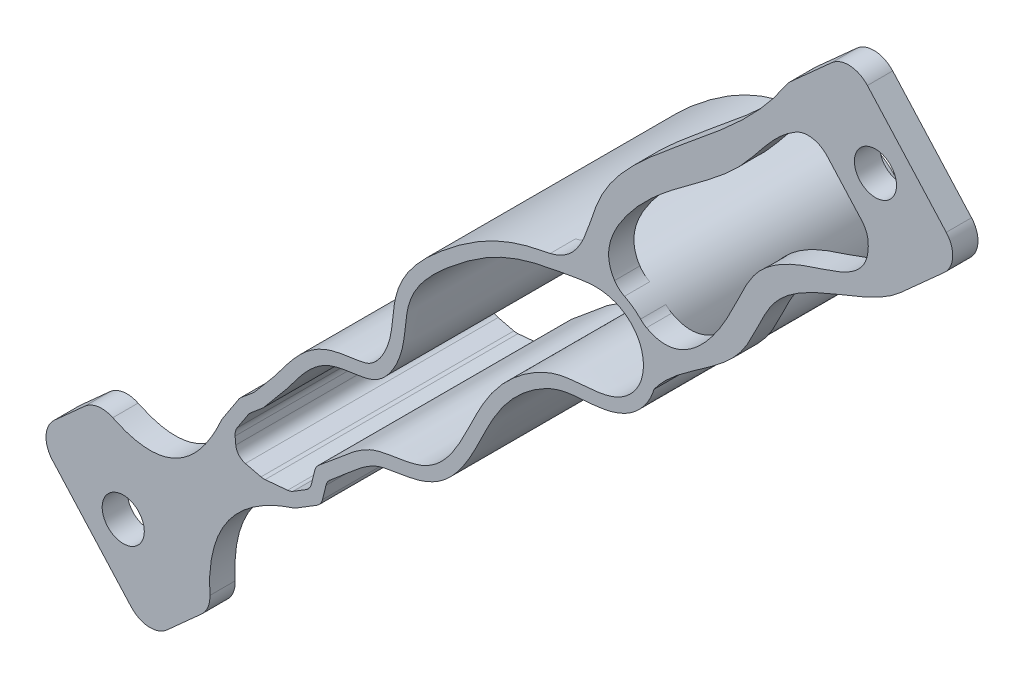
from build123d import *

# Parameters (mm, degrees)
AUFSATZ_LINEAR_AUSTRAGEN1_DEPTH = 30
SKIZZE4_R                       = 2.5
AUFSATZ_LINEAR_AUSTRAGEN2_DEPTH = 3
VERRUNDUNG5_R                   = 3
VERRUNDUNG6_R                   = 1.5


# Read off the part's stored shape, not the designer's step: Aufsatz-Linear austragen1
with BuildPart() as part:
    # Aufsatz-Linear austragen1 outline → Aufsatz-Linear austragen1 (new body)
    with BuildSketch(Plane.XY):
        with BuildLine():
            Line((21.502621057, 72.469360005), (22.177877758, 75.237826578))
            add(Edge.make_bspline(
                [(22.177877758, 75.237826578), (22.254256124, 75.299864428), (22.401406283, 75.416739858), (22.754083676, 75.691285806), (23.277364922, 76.10757001), (23.875701394, 76.622425746), (24.647522639, 77.304476478), (25.579741944, 78.125858601), (26.660997946, 78.968105965), (27.696607507, 79.586792473), (28.631268767, 79.929206924), (29.970663186, 80.187124193), (31.559028302, 80.417471171), (33.35144059, 80.779313105), (35.30968719, 81.656906085), (36.829680735, 82.918083951), (38.436897478, 84.838185933), (39.883208597, 87.452574238), (41.318550587, 90.52644951), (42.738396859, 93.001025129), (44.412581155, 95.03705019), (46.405889796, 96.758782997), (48.313567649, 97.879876665), (49.811329694, 98.417647898), (50.922124033, 98.632157767), (52.331756866, 98.757646615), (53.942485181, 98.877946479), (55.518870379, 99.103340596), (56.913656853, 99.546285355), (58.001421873, 100.091720884), (58.975778788, 100.82811088), (59.811633543, 101.71853364), (60.492503588, 102.754822756), (60.988413159, 103.947261816), (61.233819472, 105.212823321), (61.239900068, 106.889450409), (60.805664637, 108.527353464), (59.865073844, 110.019475832), (58.686693643, 111.231611144), (57.287286599, 112.057728079), (55.73639162, 112.51185954), (54.241451724, 112.694379486), (52.557511214, 112.580640152), (50.900308103, 112.278519561), (49.028258896, 111.949905855), (46.668529461, 111.509257638), (43.782844471, 110.680507348), (41.243036148, 109.514515987), (39.102547034, 108.207509439), (37.414184715, 107.011672545), (35.640883022, 105.599618111), (33.661677283, 103.843992247), (32.080114304, 102.019591381), (31.043875531, 100.300674013), (30.438792823, 98.79955445), (30.13880339, 97.341373341), (29.992721316, 96.055411287), (29.879519712, 94.90912216), (29.681769358, 93.623299713), (29.1603909, 92.05102678), (28.339762848, 90.768505317), (27.635981643, 90.10581023), (27.217269934, 89.846143896), (26.877783825, 89.708231837), (26.409438656, 89.569512488), (25.627679248, 89.428102345), (24.427519261, 89.274247733), (23.249472433, 89.068255199), (22.225694736, 88.768681136), (21.137853335, 88.320349733), (19.957924312, 87.556139753), (18.818781666, 86.511882155), (17.554921806, 85.065772551), (16.579598585, 83.705497378), (15.781602284, 82.684970689), (15.146612066, 81.91384843), (14.544102184, 81.206855981), (13.999836903, 80.572985234), (13.68706761, 80.208891755), (13.536003767, 80.032532964)],
                knots=[0.373322978, 0.373322978, 0.373322978, 0.373322978, 0.376528797, 0.379734617, 0.386146256, 0.392557895, 0.398969535, 0.411792813, 0.424616091, 0.43743937, 0.450262648, 0.463085927, 0.475909205, 0.488732483, 0.501555762, 0.51437904, 0.527202319, 0.552848875, 0.578495432, 0.604141989, 0.629788546, 0.655435103, 0.681081659, 0.693904938, 0.706728216, 0.719551495, 0.732374773, 0.745198051, 0.751609691, 0.75802133, 0.764432969, 0.770844608, 0.777256247, 0.783667887, 0.790079526, 0.796491165, 0.809314443, 0.815726083, 0.822137722, 0.834961, 0.841372639, 0.847784279, 0.860607557, 0.873430835, 0.886254114, 0.911900671, 0.937547227, 0.963193784, 0.976017063, 0.988840341, 1.001663619, 1.014486898, 1.027310176, 1.033721815, 1.040133455, 1.046545094, 1.052956733, 1.059368372, 1.065780011, 1.07860329, 1.091426568, 1.097838207, 1.104249847, 1.107455666, 1.110661486, 1.117073125, 1.123484764, 1.129896403, 1.133102223, 1.136308043, 1.142719682, 1.149131321, 1.15554296, 1.168366239, 1.174777878, 1.181189517, 1.187601156, 1.190806976, 1.194012795, 1.194012795, 1.194012795, 1.194012795], degree=3))
            Line((13.536003767, 80.032532964), (11.822906277, 78.595073491))
            Line((11.822906277, 78.595073491), (9.687044037, 75.317164454))
            Line((9.687044037, 75.317164454), (10.053403602, 71.255635543))
            Line((10.053403602, 71.255635543), (14.475267585, 70.177098668))
            Line((14.475267585, 70.177098668), (18.341234762, 70.5258181))
            Line((18.341234762, 70.5258181), (21.502621057, 72.469360005))
        make_face()
        with BuildLine():
            add(Edge.make_bspline(
                [(20.834793722, 76.061451858), (20.982005484, 76.196777022), (21.276446541, 76.443244796), (21.809392251, 76.854719355), (22.395228981, 77.325787697), (23.161775957, 77.989275726), (24.12322295, 78.850039457), (25.299890873, 79.831893247), (26.523519613, 80.666838055), (28.159762679, 81.438240117), (30.179083341, 81.717053226), (32.323329198, 82.079584767), (33.946931742, 82.624375114), (35.333501298, 83.577165331), (36.842393369, 85.174069178), (38.282016568, 87.588894944), (39.735209989, 90.694487024), (41.240682307, 93.479520835), (43.046396867, 95.788146816), (45.191944861, 97.735197117), (47.298908301, 99.057741191), (49.070157619, 99.767787687), (50.85008262, 100.183465945), (52.878076716, 100.274128046), (55.100072487, 100.538144068), (56.867295949, 101.083413553), (58.430174676, 102.286080097), (59.501852985, 103.961784273), (59.848216567, 105.969747456), (59.46188968, 107.932703522), (58.316760191, 109.628882316), (56.681834243, 110.718732589), (54.808980056, 111.194995787), (53.031772201, 111.127349342), (51.399125844, 110.84794883), (49.466716943, 110.501377151), (47.166795584, 110.082199501), (44.453627463, 109.321992035), (41.618592742, 108.050721353), (39.028143269, 106.370709826), (36.729284053, 104.552504665), (34.837130056, 102.890799513), (33.37546251, 101.234271806), (32.449215546, 99.738391359), (31.747307515, 98.083258171), (31.479504351, 95.97512579), (31.282650556, 93.70034002), (30.56287413, 91.475874003), (29.568389599, 89.875995413), (28.597006456, 88.940107724), (27.811516639, 88.438318776), (26.924604688, 88.136661039), (25.835020273, 87.942161361), (24.62881228, 87.786947522), (23.35652081, 87.564805619), (22.030199882, 87.110465523), (20.474275175, 86.097963756), (18.958316824, 84.446558328), (17.758061478, 82.775704685), (16.910126576, 81.694228865), (16.246871139, 80.891606673), (15.624903688, 80.162882321), (15.067148562, 79.51349651), (14.748876803, 79.142916853), (14.595029918, 78.963050482)],
                knots=[0.367648597, 0.367648597, 0.367648597, 0.367648597, 0.374108802, 0.380569007, 0.387029212, 0.393489418, 0.406409828, 0.419330238, 0.432250648, 0.445171059, 0.471011879, 0.483932289, 0.4968527, 0.50977311, 0.52269352, 0.548534341, 0.574375161, 0.600215982, 0.626056802, 0.651897623, 0.677738443, 0.690658853, 0.703579264, 0.729420084, 0.742340494, 0.755260904, 0.768181315, 0.781101725, 0.794022135, 0.806942545, 0.819862956, 0.832783366, 0.845703776, 0.858624186, 0.871544597, 0.884465007, 0.910305827, 0.936146648, 0.961987468, 0.987828289, 1.000748699, 1.013669109, 1.02658952, 1.033049725, 1.03950993, 1.05243034, 1.06535075, 1.078271161, 1.091191571, 1.097651776, 1.104111981, 1.110572186, 1.117032391, 1.123492596, 1.129952802, 1.136413007, 1.142873212, 1.155793622, 1.168714032, 1.175174237, 1.181634443, 1.188094648, 1.19132475, 1.194554853, 1.194554853, 1.194554853, 1.194554853], degree=3))
            Line((20.834793722, 76.061451858), (20.191521996, 73.424119612))
            Line((20.191521996, 73.424119612), (17.855695294, 71.988111274))
            Line((17.855695294, 71.988111274), (14.588656062, 71.693416567))
            Line((14.588656062, 71.693416567), (11.450971684, 72.458729186))
            Line((11.450971684, 72.458729186), (11.227697925, 74.93398277))
            Line((11.227697925, 74.93398277), (12.957915036, 77.589347988))
            Line((12.957915036, 77.589347988), (14.595029918, 78.963050482))
        make_face(mode=Mode.SUBTRACT)
    extrude(amount=AUFSATZ_LINEAR_AUSTRAGEN1_DEPTH)

    # Skizze4 → Aufsatz-Linear austragen2 (add)
    # profile 1 of 4: a face of its own
    with BuildSketch(Plane.XY.offset(30)):
        Polygon((84.30628697, 150.190951605), (76.866971114, 143.508393742), (80.184370385, 139.815319698), (86.235506325, 133.078930359), (90.232086841, 128.62976203), (97.671402697, 135.312319894), align=None)
        with Locations((87.269186906, 139.410356818)):
            Circle(SKIZZE4_R, mode=Mode.SUBTRACT)
    # profile 2 of 4: a face of its own
    with BuildSketch(Plane.XY.offset(30)):
        with BuildLine():
            add(Edge.make_bspline(
                [(-4.965503299, 70.000257243), (4.653267601, 63.937882303), (9.687044037, 75.317164454)],
                knots=[0, 0, 0, 1, 1, 1], degree=2))
            Line((-4.965503299, 70.000257243), (-12.404819154, 63.31769938))
            Line((-12.404819154, 63.31769938), (0.960296573, 48.439067669))
            Line((0.960296573, 48.439067669), (8.399612428, 55.121625532))
            add(Edge.make_bspline(
                [(8.399612428, 55.121625532), (6.958597909, 66.912785044), (18.341234762, 70.5258181)],
                knots=[0, 0, 0, 1, 1, 1], degree=2))
            Line((18.341234762, 70.5258181), (14.475267585, 70.177098668))
            Line((14.475267585, 70.177098668), (10.053403602, 71.255635543))
            Line((10.053403602, 71.255635543), (9.687044037, 75.317164454))
        make_face()
        with Locations((-2.002603363, 59.219662456)):
            Circle(SKIZZE4_R, mode=Mode.SUBTRACT)
    # profile 3 of 4: a face of its own
    with BuildSketch(Plane.XY.offset(30)):
        with BuildLine():
            add(Edge.make_bspline(
                [(76.866971114, 143.508393742), (72.687124199, 136.816455913), (63.441453447, 131.01252398), (53.186506212, 120.519346265), (52.716796175, 112.832236542), (48.673620881, 111.880000188)],
                knots=[0, 0, 0, 0, 0.53661385, 0.757250372, 1, 1, 1, 1], degree=3))
            add(Edge.make_bspline(
                [(56.970920735, 112.107299655), (56.942998255, 112.118460851), (56.540848672, 112.27629926), (55.73639162, 112.51185954), (54.241451724, 112.694379486), (52.557511214, 112.580640152), (50.900308103, 112.278519561), (49.691742908, 112.066371779), (48.94790706, 111.931389695), (48.673620881, 111.880000188)],
                knots=[0.83448128, 0.83448128, 0.83448128, 0.83448128, 0.834961, 0.841372639, 0.847784279, 0.860607557, 0.873430835, 0.886254114, 0.893721575, 0.893721575, 0.893721575, 0.893721575], degree=3))
            add(Edge.make_bspline(
                [(80.184370385, 139.815319698), (75.990201828, 138.933187042), (72.584052914, 132.31282939), (64.170338621, 126.584430646), (57.272780707, 120.901290436), (54.471534874, 114.628286126), (56.970920735, 112.107299655)],
                knots=[0, 0, 0, 0, 0.30056311, 0.538693516, 0.776641932, 1, 1, 1, 1], degree=3))
            Line((80.184370385, 139.815319698), (76.866971114, 143.508393742))
        make_face()
    # profile 4 of 4: a face of its own
    with BuildSketch(Plane.XY.offset(30)):
        with BuildLine():
            add(Edge.make_bspline(
                [(59.617271544, 110.247553178), (63.047559231, 107.929173518), (67.733244382, 111.873838834), (70.674264291, 117.63738977), (73.095681063, 123.013626242), (80.123198939, 126.782303045), (87.373632344, 127.744521925), (86.235506325, 133.078930359)],
                knots=[0, 0, 0, 0, 0.257721745, 0.394279778, 0.519939816, 0.701469645, 1, 1, 1, 1], degree=3))
            add(Edge.make_bspline(
                [(60.975917609, 104.05941602), (61.083227432, 104.4375738), (61.233942833, 105.246837969), (61.239900068, 106.889450409), (60.805664637, 108.527353464), (60.037500132, 109.745944427), (59.691936118, 110.162315456), (59.617271544, 110.247553178)],
                knots=[0.784188192, 0.784188192, 0.784188192, 0.784188192, 0.790079526, 0.796491165, 0.809314443, 0.815726083, 0.817436272, 0.817436272, 0.817436272, 0.817436272], degree=3))
            add(Edge.make_bspline(
                [(90.232086841, 128.62976203), (86.072016969, 124.9435297), (75.385225475, 124.200459083), (71.588729862, 110.455138371), (63.689553802, 107.891526152), (60.975917609, 104.05941602)],
                knots=[0, 0, 0, 0, 0.441047072, 0.642356682, 1, 1, 1, 1], degree=3))
            Line((90.232086841, 128.62976203), (86.235506325, 133.078930359))
        make_face()
    extrude(amount=-AUFSATZ_LINEAR_AUSTRAGEN2_DEPTH)

    # Verrundung5
    verrundung5_edges = [part.edges().sort_by_distance(p)[0] for p in [
        (0.960296573, 48.439067669, 28.5),
        (8.399612428, 55.121625532, 28.5),
        (-4.965503299, 70.000257243, 28.5),
        (-12.404819154, 63.31769938, 28.5),
        (84.30628697, 150.190951605, 28.5),
        (97.671402697, 135.312319894, 28.5),
        (59.617271544, 110.247553178, 28.5),
        (56.970920735, 112.107299655, 28.5),
        (86.235506325, 133.078930359, 28.5),
        (80.184370385, 139.815319698, 28.5),
        (76.866971114, 143.508393742, 28.5),
        (90.232086841, 128.62976203, 28.5),
    ]]
    fillet(verrundung5_edges, radius=VERRUNDUNG5_R)

    # Verrundung6
    verrundung6_edges = [part.edges().sort_by_distance(p)[0] for p in [
        (21.502621057, 72.469360005, 15),
        (22.177877758, 75.237826578, 15),
        (11.822906277, 78.595073491, 15),
        (13.536003767, 80.032532964, 15),
        (20.834793722, 76.061451858, 15),
        (20.191521996, 73.424119612, 15),
        (17.855695294, 71.988111274, 15),
        (14.588656062, 71.693416567, 15),
        (11.450971684, 72.458729186, 15),
        (11.227697925, 74.93398277, 15),
        (12.957915036, 77.589347988, 15),
        (14.595029918, 78.963050482, 15),
    ]]
    fillet(verrundung6_edges, radius=VERRUNDUNG6_R)


solid = part.part
